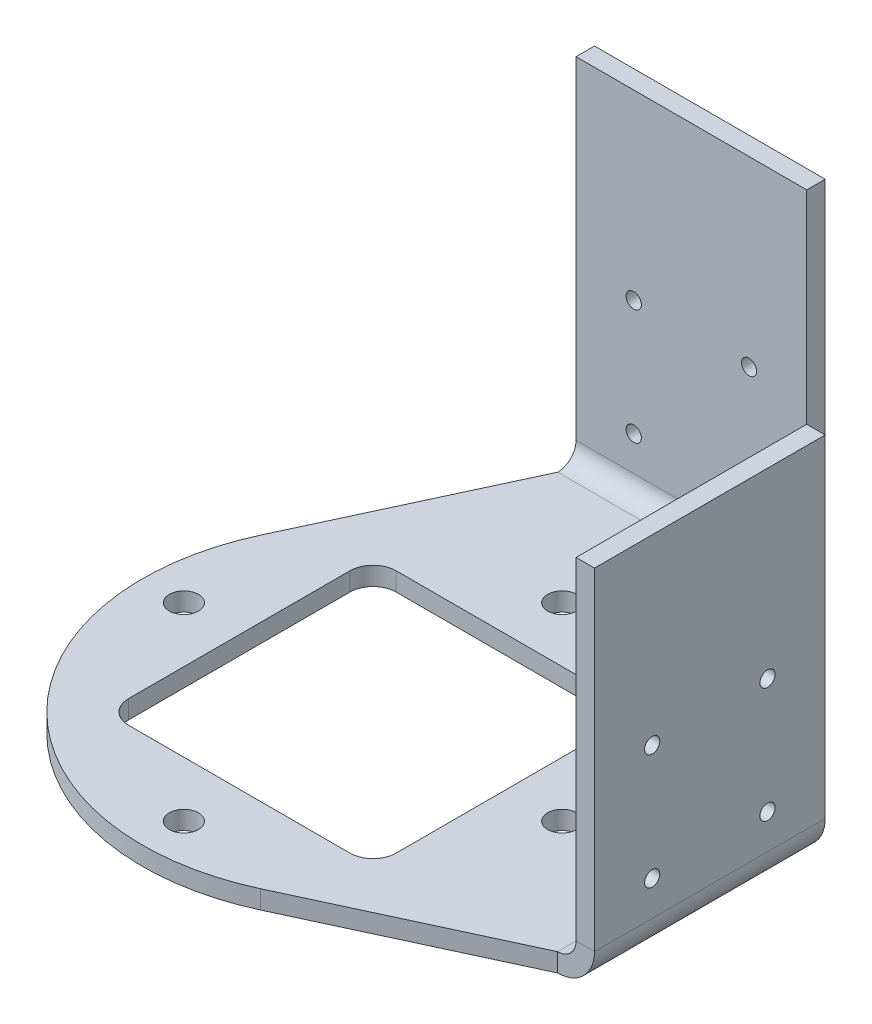
from build123d import *

# Parameters (mm, degrees)
SKETCH_1_R                  = 3.15
EXTRUDE_1_DEPTH             = 4
SM_EDGE_FLANGE_1_DEPTH      = 50
SM_EDGE_FLANGE_1_BEND_DEPTH = 50
SKETCH_21_R                 = 1.65
CUT_EXTRUDE_1_DEPTH         = 161.903697907
SKETCH_22_R                 = 1.65
CUT_EXTRUDE_2_DEPTH         = 161.903697907


# Sheet-metal steps are written as plain solids
with BuildPart() as part:
    # Sketch 1 → 凸台-拉伸1 (new body)
    with BuildSketch(Plane(origin=(0, 0, 0), x_dir=(1, 0, 0), z_dir=(0, 1, 0))):
        with BuildLine():
            Line((-25, 65), (-45.371050591, 21.011134388))
            ThreePointArc((-45.371050591, 21.011134388), (-35.355339059, -35.355339059), (21.011134388, -45.371050591))
            Line((21.011134388, -45.371050591), (65, -25))
            Line((65, -25), (65, 25))
            Line((65, 25), (37.660706721, 37.660706721))
            Line((37.660706721, 37.660706721), (25, 65))
            Line((25, 65), (-25, 65))
        make_face()
        with Locations(Location((0, 41, 0), (0, 0, 270))):
            Circle(SKETCH_1_R, mode=Mode.SUBTRACT)
        with Locations(Location((0, -41, 0), (0, 0, 270))):
            Circle(SKETCH_1_R, mode=Mode.SUBTRACT)
        with Locations(Location((-41, 0, 0), (0, 0, 270))):
            Circle(SKETCH_1_R, mode=Mode.SUBTRACT)
        with BuildLine():
            ThreePointArc((29, -24), (27.535533906, -27.535533906), (24, -29))
            Line((24, -29), (-24, -29))
            ThreePointArc((-24, -29), (-27.535533906, -27.535533906), (-29, -24))
            Line((-29, -24), (-29, 24))
            ThreePointArc((-29, 24), (-27.535533906, 27.535533906), (-24, 29))
            Line((-24, 29), (24, 29))
            ThreePointArc((24, 29), (27.535533906, 27.535533906), (29, 24))
            Line((29, 24), (29, -24))
        make_face(mode=Mode.SUBTRACT)
        with Locations(Location((41, 0, 0), (0, 0, 270))):
            Circle(SKETCH_1_R, mode=Mode.SUBTRACT)
    extrude(amount=EXTRUDE_1_DEPTH)

    # 边线-法兰1 section (across the edge) → 边线-法兰1 (add)
    with BuildSketch(Plane(origin=(69, 4, 25), x_dir=(-1, 0, 0), z_dir=(0, 0, -1))):
        with BuildLine():
            Line((-4, 4), (-4, 76))
            Line((-4, 76), (0, 76))
            Line((0, 76), (0, 4))
            ThreePointArc((0, 4), (1.171572875, 1.171572875), (4, 0))
            Line((4, 0), (4, -4))
            ThreePointArc((4, -4), (-1.656854249, -1.656854249), (-4, 4))
        make_face()
    extrude(amount=SM_EDGE_FLANGE_1_DEPTH)

    # 边线-法兰1 section 2 (across the edge) → 边线-法兰1 bend (add)
    with BuildSketch(Plane(origin=(25, 4, -69), x_dir=(0, 0, 1), z_dir=(-1, 0, 0))):
        with BuildLine():
            Line((-4, 4), (-4, 76))
            Line((-4, 76), (0, 76))
            Line((0, 76), (0, 4))
            ThreePointArc((0, 4), (1.171572875, 1.171572875), (4, 0))
            Line((4, 0), (4, -4))
            ThreePointArc((4, -4), (-1.656854249, -1.656854249), (-4, 4))
        make_face()
    extrude(amount=SM_EDGE_FLANGE_1_BEND_DEPTH)

    # 草图21 → 切除-拉伸1 (cut, through all)
    with BuildSketch(Plane.XY.offset(-69)):
        with Locations((-12.5, 40.5)):
            Circle(SKETCH_21_R)
        with Locations(Location((12.5, 40.5, 0), (0, 0, 180))):
            Circle(SKETCH_21_R)
        with Locations((12.5, 15.5)):
            Circle(SKETCH_21_R)
        with Locations(Location((-12.5, 15.5, 0), (0, 0, 180))):
            Circle(SKETCH_21_R)
    extrude(amount=-CUT_EXTRUDE_1_DEPTH, mode=Mode.SUBTRACT)

    # 草图22 → 切除-拉伸2 (cut, through all)
    with BuildSketch(Plane.ZY.offset(-69)):
        with Locations(Location((-12.5, 40.5, 0), (0, 0, 270))):
            Circle(SKETCH_22_R)
        with Locations(Location((12.5, 40.5, 0), (0, 0, 90))):
            Circle(SKETCH_22_R)
        with Locations(Location((12.5, 15.5, 0), (0, 0, 270))):
            Circle(SKETCH_22_R)
        with Locations(Location((-12.5, 15.5, 0), (0, 0, 90))):
            Circle(SKETCH_22_R)
    extrude(amount=-CUT_EXTRUDE_2_DEPTH, mode=Mode.SUBTRACT)


solid = part.part
